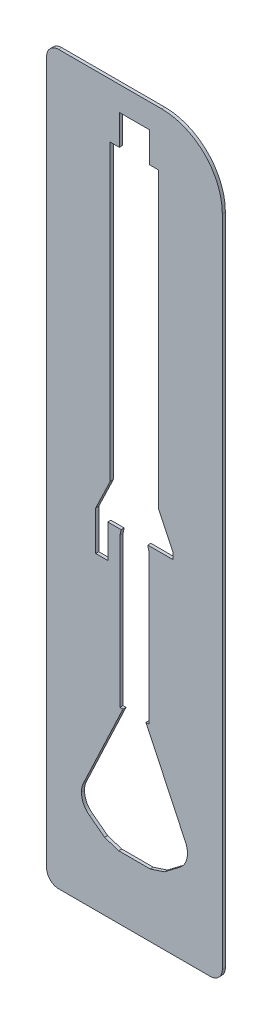
from build123d import *

# Parameters (mm, degrees)
BOSS_EXTRUDE5_DEPTH = 0.508
CUT_EXTRUDE1_DEPTH  = 62.729312842


with BuildPart() as part:
    # Sketch11 → Boss-Extrude5 (new body)
    with BuildSketch(Plane.XY):
        with BuildLine():
            Line((-12.5, 60), (4.5, 60))
            ThreePointArc((4.5, 60), (11.571067812, 57.071067812), (14.5, 50))
            Line((14.5, 50), (14.5, -58))
            ThreePointArc((14.5, -58), (13.914213562, -59.414213562), (12.5, -60))
            Line((12.5, -60), (-12.5, -60))
            ThreePointArc((-12.5, -60), (-13.914213562, -59.414213562), (-14.5, -58))
            Line((-14.5, -58), (-14.5, 58))
            ThreePointArc((-14.5, 58), (-13.914213562, 59.414213562), (-12.5, 60))
        make_face()
    extrude(amount=BOSS_EXTRUDE5_DEPTH)

    # Sketch1 → Cut-Extrude1 (cut, through all)
    with BuildSketch(Plane.XY.offset(0.508)):
        with BuildLine():
            Line((2.5, 56), (-2.5, 56))
            Line((-2.5, 56), (-2.5, 51))
            Line((-2.5, 51), (-4, 51))
            Line((-4, 51), (-4, 2.5))
            Line((-4, 2.5), (-6.4, -2.5))
            Line((-6.4, -2.5), (-6.4, -9))
            Line((-6.4, -9), (-4.4, -9))
            Line((-4.4, -9), (-4.4, -3.5))
            Line((-4.4, -3.5), (-2.2, -3.5))
            Line((-2.2, -3.5), (-2.4, -4.42))
            Line((-2.4, -4.42), (-2.4, -29))
            Line((-2.4, -29), (-1.9, -29))
            Line((-1.9, -29), (-8.375, -42.75))
            add(Edge.make_bspline(
                [(-8.375, -42.75), (-8.614001568, -43.20601542), (-8.749703343, -43.736930638), (-8.75, -44.3)],
                knots=[2, 2, 2, 2, 3, 3, 3, 3], degree=3))
            add(Edge.make_bspline(
                [(-8.75, -44.3), (-8.75059415, -45.427724457), (-8.211440188, -46.416320927), (-7.4, -46.97314145)],
                knots=[3, 3, 3, 3, 3.998304655, 3.998304655, 3.998304655, 3.998304655], degree=3))
            Line((-7.4, -46.97314145), (-4.925, -48.85))
            Line((-4.925, -48.85), (-2.6, -49.6))
            Line((-2.6, -49.6), (2.6, -49.6))
            Line((2.6, -49.6), (4.925, -48.85))
            Line((4.925, -48.85), (7.4, -46.97314145))
            add(Edge.make_bspline(
                [(7.4, -46.97314145), (8.211440188, -46.416320927), (8.75059415, -45.427724457), (8.75, -44.3)],
                knots=[3, 3, 3, 3, 3.998304655, 3.998304655, 3.998304655, 3.998304655], degree=3))
            add(Edge.make_bspline(
                [(8.75, -44.3), (8.749703343, -43.736930638), (8.614001568, -43.20601542), (8.375, -42.75)],
                knots=[2, 2, 2, 2, 3, 3, 3, 3], degree=3))
            Line((8.375, -42.75), (1.9, -29))
            Line((1.9, -29), (2.4, -29))
            Line((2.4, -29), (2.4, -4.42))
            Line((2.4, -4.42), (2.2, -3.5))
            Line((2.2, -3.5), (6.4, -3.5))
            Line((6.4, -3.5), (6.4, -2.5))
            Line((6.4, -2.5), (4, 2.5))
            Line((4, 2.5), (4, 51))
            Line((4, 51), (2.5, 51))
            Line((2.5, 51), (2.5, 56))
        make_face()
    extrude(amount=-CUT_EXTRUDE1_DEPTH, mode=Mode.SUBTRACT)


solid = part.part
